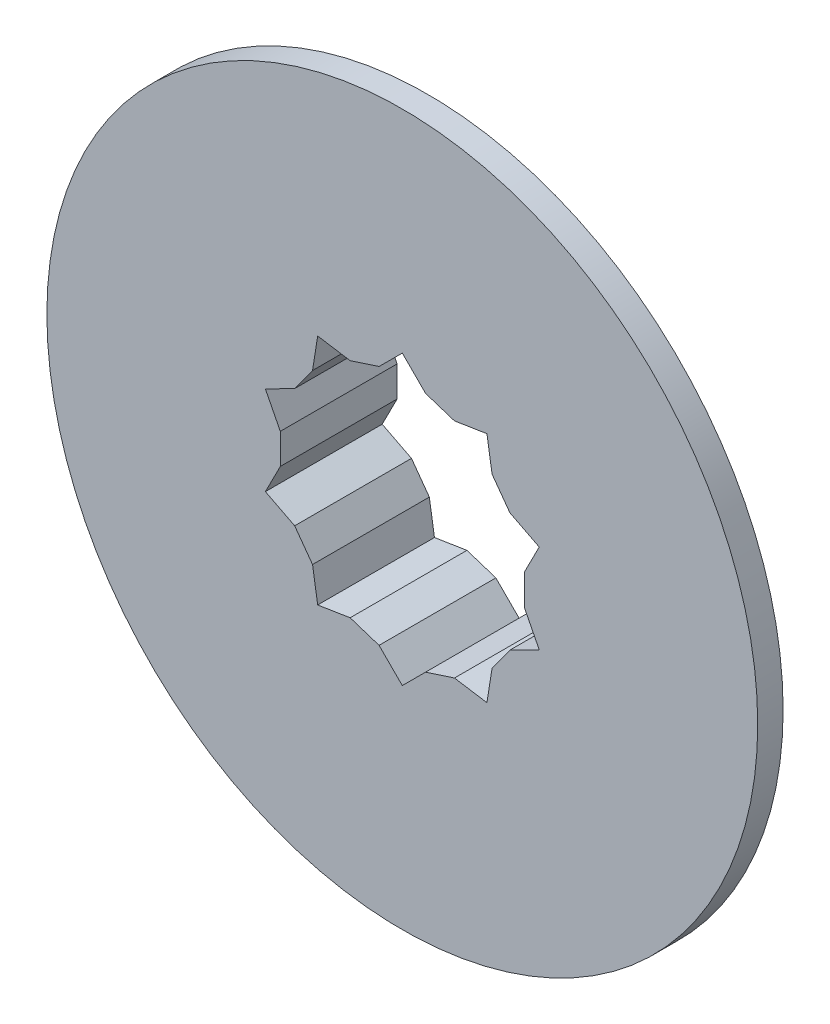
from build123d import *

# Parameters (mm, degrees)
SKETCH1_R           = 30
BOSS_EXTRUDE1_DEPTH = 18
SKETCH2_R           = 70
BOSS_EXTRUDE2_DEPTH = 5
CUT_EXTRUDE1_DEPTH  = 45


with BuildPart() as part:
    # Sketch1 → Boss-Extrude1 (new body)
    with BuildSketch(Plane.XY):
        Circle(SKETCH1_R)
    extrude(amount=BOSS_EXTRUDE1_DEPTH)

    # Sketch2 → Boss-Extrude2 (add)
    with BuildSketch(Plane.XY.offset(18)):
        Circle(SKETCH2_R)
    extrude(amount=BOSS_EXTRUDE2_DEPTH)

    # Sketch5 → Cut-Extrude1 (cut)
    with BuildSketch(Plane(origin=(0, 0, 0), x_dir=(-1, 0, 0), z_dir=(0, 0, -1))):
        Polygon((0, 28.353553391), (-4.577283355, 23.776270035), (-10.272240859, 21.925866173), (-16.665800533, 22.938506544), (-17.678440904, 16.54494687), (-21.198118206, 11.700526666), (-26.965831712, 8.761729849), (-24.027034895, 2.994016342), (-24.027034895, -2.994016342), (-26.965831712, -8.761729849), (-21.198118206, -11.700526666), (-17.678440904, -16.54494687), (-16.665800533, -22.938506544), (-10.272240859, -21.925866173), (-4.577283355, -23.776270035), (0, -28.353553391), (4.577283355, -23.776270035), (10.272240859, -21.925866173), (16.665800533, -22.938506544), (17.678440904, -16.54494687), (21.198118206, -11.700526666), (26.965831712, -8.761729849), (24.027034895, -2.994016342), (24.027034895, 2.994016342), (26.965831712, 8.761729849), (21.198118206, 11.700526666), (17.678440904, 16.54494687), (16.665800533, 22.938506544), (10.272240859, 21.925866173), (4.577283355, 23.776270035), align=None)
    extrude(amount=-CUT_EXTRUDE1_DEPTH, mode=Mode.SUBTRACT)


solid = part.part
